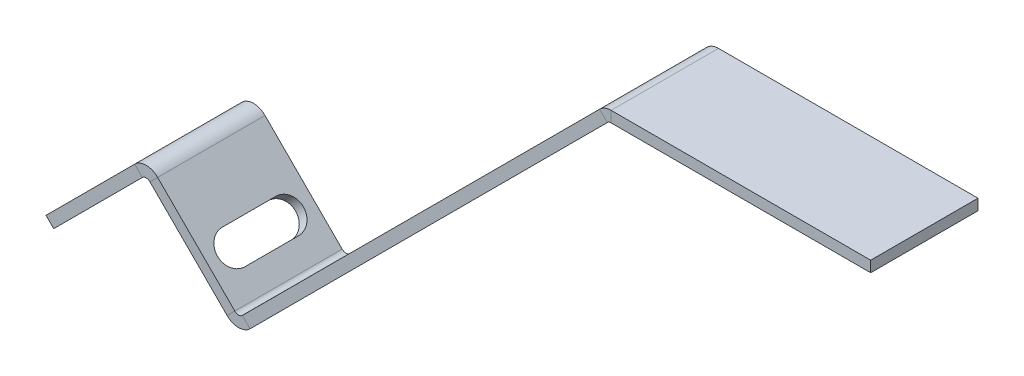
from build123d import *

# Parameters (mm, degrees)
BASE_FLANGE1_DEPTH = 10
CUT_EXTRUDE1_DEPTH = 2.032
CUT_EXTRUDE2_DEPTH = 2.032


# Sheet-metal steps are written as plain solids
with BuildPart() as part:
    # Sketch1 → Base-Flange1 (new, symmetric)
    with BuildSketch(Plane.XY):
        with BuildLine():
            Line((-17.225320151, -6), (-0.707106781, 10.51821337))
            ThreePointArc((-0.707106781, 10.51821337), (0, 10.811106589), (0.707106781, 10.51821337))
            Line((0.707106781, 10.51821337), (15.081372391, -3.856052239))
            ThreePointArc((15.081372391, -3.856052239), (17.225320151, -4.744104479), (19.369267912, -3.856052239))
            Line((19.369267912, -3.856052239), (85.932426933, 62.707106781))
            ThreePointArc((85.932426933, 62.707106781), (86.256850281, 62.923879533), (86.639533714, 63))
            Line((86.639533714, 63), (135, 63))
            Line((135, 63), (135, 65.032))
            Line((135, 65.032), (86.639533714, 65.032))
            ThreePointArc((86.639533714, 65.032), (85.479237547, 64.801202743), (84.495585953, 64.143947761))
            Line((84.495585953, 64.143947761), (17.932426933, -2.41921126))
            ThreePointArc((17.932426933, -2.41921126), (17.225320151, -2.712104479), (16.51821337, -2.41921126))
            Line((16.51821337, -2.41921126), (2.143947761, 11.95505435))
            ThreePointArc((2.143947761, 11.95505435), (0, 12.843106589), (-2.143947761, 11.95505435))
            Line((-2.143947761, 11.95505435), (-18.662161131, -4.563159021))
            Line((-18.662161131, -4.563159021), (-17.225320151, -6))
        make_face()
    extrude(amount=BASE_FLANGE1_DEPTH, both=True)

    # Sketch6 → Cut-Extrude1 (cut)
    with BuildSketch(Plane(origin=(-7.049501055, 7.049501055, 0), x_dir=(0, 0, 1), z_dir=(-0.7071067811865488, 0.7071067811865464, 0))):
        with BuildLine():
            Line((-5, -5), (5, -5))
            ThreePointArc((5, -5), (8, -8), (5, -11))
            Line((5, -11), (-5, -11))
            ThreePointArc((-5, -11), (-8, -8), (-5, -5))
        make_face()
    extrude(amount=-CUT_EXTRUDE1_DEPTH, mode=Mode.SUBTRACT)

    # Sketch9 → Cut-Extrude2 (cut)
    with BuildSketch(Plane(origin=(7.049501055, 7.049501055, 0), x_dir=(0, 0, -1), z_dir=(0.7071067811865488, 0.7071067811865464, 0))):
        with BuildLine():
            Line((-5, -3), (5, -3))
            ThreePointArc((5, -3), (8, -6), (5, -9))
            Line((5, -9), (-5, -9))
            ThreePointArc((-5, -9), (-8, -6), (-5, -3))
        make_face()
    extrude(amount=-CUT_EXTRUDE2_DEPTH, mode=Mode.SUBTRACT)


solid = part.part
